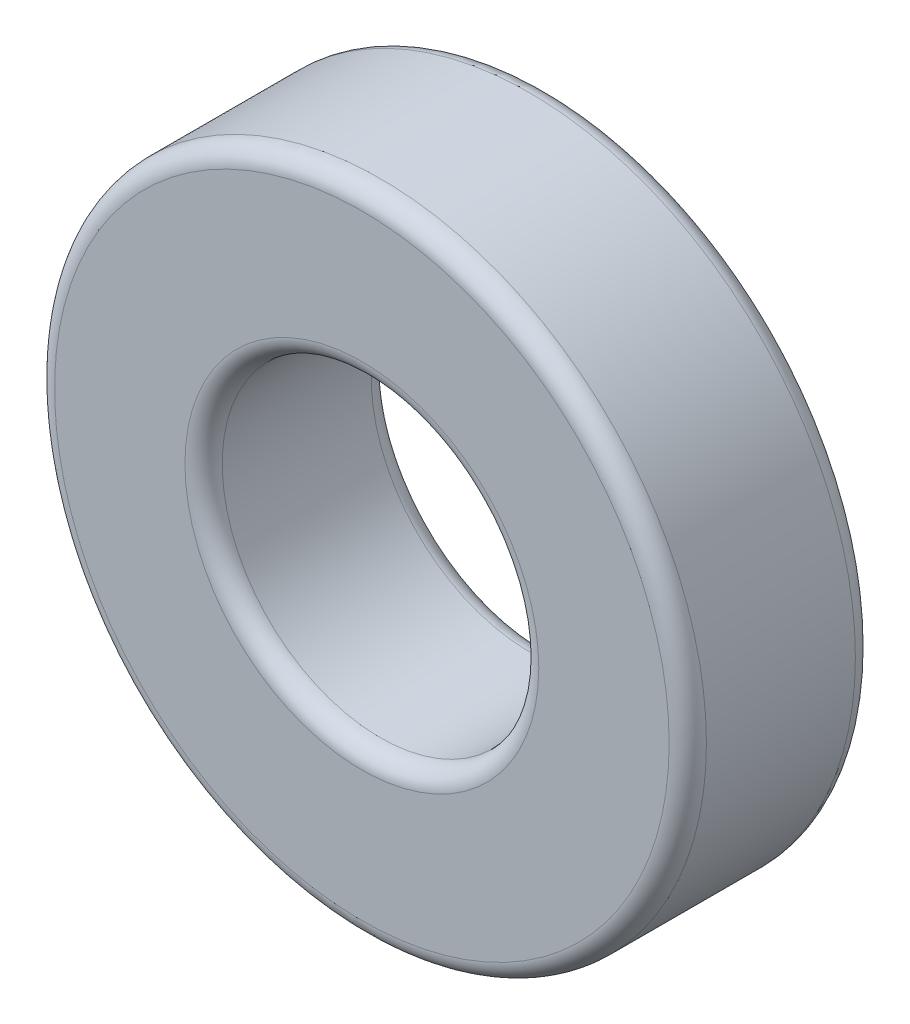
from build123d import *

# Parameters (mm, degrees)
SKETCH1_R           = 17.5
SKETCH1_R_2         = 8.5
BOSS_EXTRUDE1_DEPTH = 10
FILLET1_R           = 1


with BuildPart() as part:
    # Sketch1 → Boss-Extrude1 (new body)
    with BuildSketch(Plane.XY):
        Circle(SKETCH1_R)
        Circle(SKETCH1_R_2, mode=Mode.SUBTRACT)
    extrude(amount=BOSS_EXTRUDE1_DEPTH)

    # Fillet1
    fillet1_edges = [part.edges().sort_by_distance(p)[0] for p in [
        (-8.5, 0, 0),
        (-8.5, 0, 10),
        (-17.5, 0, 0),
        (-17.5, 0, 10),
    ]]
    fillet(fillet1_edges, radius=FILLET1_R)


solid = part.part
